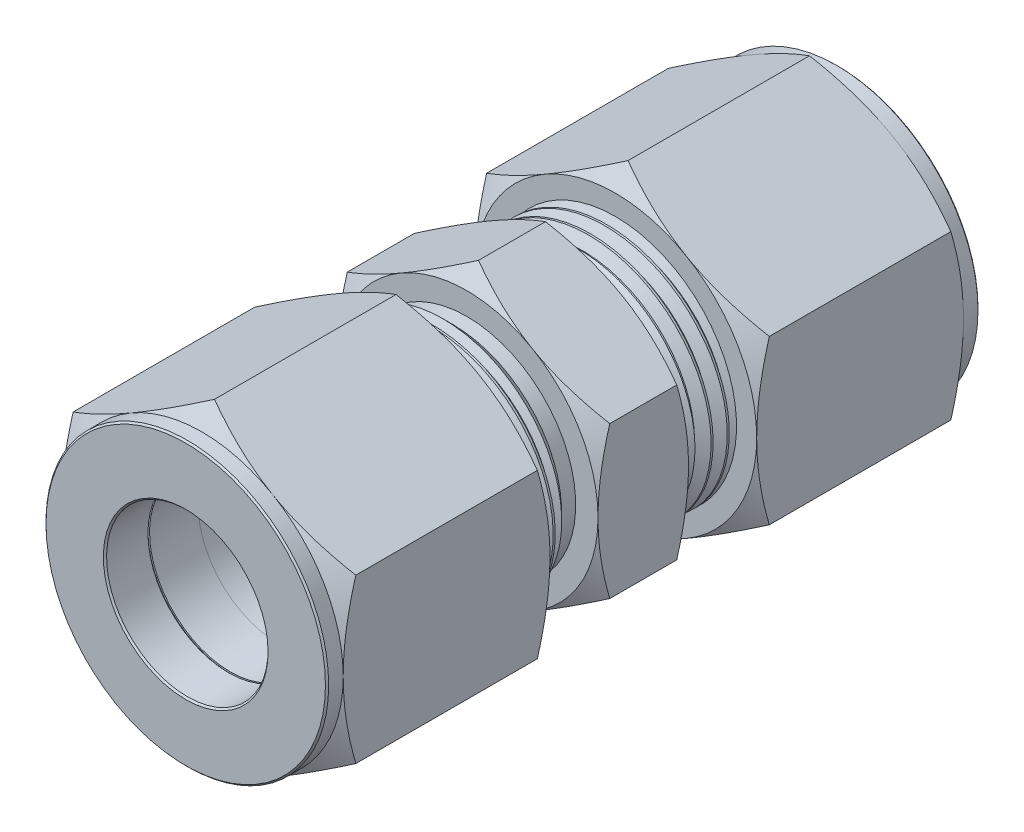
from build123d import *

# Parameters (mm, degrees)
BOSS_EXTRUDE1_DEPTH = 17.526
CHAMFER1_SIZE       = 0.127
SKETCH4_W           = 15.494
SKETCH4_H           = 9.525
CUT_SWEEP1_PITCH    = 1.27
BOSS_EXTRUDE2_DEPTH = 3.556
CIRPATTERN1_COUNT   = 2


with BuildPart() as part:
    # Sketch2 → Boss-Extrude1 (new body)
    with BuildSketch(Plane.XY):
        Polygon((0, 12.831609733), (-11.1125, 6.415804866), (-11.1125, -6.415804866), (0, -12.831609733), (11.1125, -6.415804866), (11.1125, 6.415804866), align=None)
    extrude(amount=-BOSS_EXTRUDE1_DEPTH)

    # Sketch3 → Cut-Revolve1 (revolve, cut)
    with BuildSketch(Plane(origin=(0, 0, 0), x_dir=(0, 0, -1), z_dir=(1, 0, 0)), mode=Mode.PRIVATE) as cut_revolve1_sk:
        Polygon((0, 12.831609733), (0, 11.1125), (1.27, 11.1125), (2.262528467, 12.831609733), (16.533471533, 12.831609733), (17.526, 11.1125), (17.526, 12.831609733), (17.526, 14.550719465), (0, 14.550719465), align=None)
        Polygon((0, 6.35), (0, 0), (17.526, 0), (17.526, 9.525), (7.0104, 9.525), (7.0104, 8.89), (3.5052, 8.89), (3.5052, 8.255), (3.5052, 6.35), align=None)
    revolve(cut_revolve1_sk.sketch.rotate(Axis((0, 0, 0), (0, 0, -1)), 180), axis=Axis((0, 0, 0), (0, 0, -1)), mode=Mode.SUBTRACT)

    # Chamfer1
    chamfer1_edges = [part.edges().sort_by_distance(p)[0] for p in [
        (0, 11.1125, 0),
        (0, 6.35, -3.5052),
        (0, 6.35, 0),
    ]]
    chamfer(chamfer1_edges, length=CHAMFER1_SIZE)


with BuildPart() as body_2:
    # Sketch4 → Revolve1 (revolve)
    with BuildSketch(Plane(origin=(0, 0, 0), x_dir=(0, 0, -1), z_dir=(1, 0, 0))):
        with Locations((17.907, 4.7625)):
            Rectangle(SKETCH4_W, SKETCH4_H)
    revolve(axis=Axis((0, 0, -25.654), (0, 0, 1)))

    # Cut-Sweep1: the profile of Sketch6 screwed along a right-hand helix of 13.2 turns, 8 arcs to a turn; built about Z, then put on its axis
    cut_sweep1_z = Axis((0, 0, 0), (0, 0, 1))
    cut_sweep1_corners = [(8.700110803, 0, -0.635), (9.593740766, 0, -1.1509375), (9.593740766, 0, 0.0396875), (8.700110803, 0, -0.47625)]
    with BuildLine(mode=Mode.PRIVATE) as cut_sweep1_profile:
        Line(cut_sweep1_corners[0], cut_sweep1_corners[1])
        Line(cut_sweep1_corners[1], cut_sweep1_corners[2])
        Line(cut_sweep1_corners[2], cut_sweep1_corners[3])
        Line(cut_sweep1_corners[3], cut_sweep1_corners[0])
    cut_sweep1_cap = Face(cut_sweep1_profile.wire())
    cut_sweep1_turn_angles = [0, 22.5, 45, 67.5, 90, 112.5, 135, 157.5, 180, 202.5, 225, 247.5, 270, 292.5, 315, 337.5, 360]
    cut_sweep1_turn_weights = [1, 0.9238795325112867, 1, 0.9238795325112867, 1, 0.9238795325112867, 1, 0.9238795325112867, 1, 0.9238795325112867, 1, 0.9238795325112867, 1, 0.9238795325112867, 1, 0.9238795325112867, 1]
    cut_sweep1_turn_rails = [Edge.make_bspline([Vector(p[0], p[1], 0).rotate(cut_sweep1_z, cut_sweep1_turn_angles[k]) / cut_sweep1_turn_weights[k] + Vector(0, 0, p[2] + CUT_SWEEP1_PITCH * cut_sweep1_turn_angles[k] / 360) for k in range(17)], [0, 0, 0, 1, 1, 2, 2, 3, 3, 4, 4, 5, 5, 6, 6, 7, 7, 8, 8, 8], 2, cut_sweep1_turn_weights) for p in cut_sweep1_corners]
    cut_sweep1_turn_sides = [Face.make_surface_from_curves(cut_sweep1_turn_rails[p[0]], cut_sweep1_turn_rails[p[1]]) for p in [(0, 1), (1, 2), (2, 3), (3, 0)]]
    cut_sweep1_last_angles = [4680, 4702.5, 4725, 4738.5, 4752]
    cut_sweep1_last_weights = [1, 0.9238795325112867, 1, 0.9723699203976544, 1]
    cut_sweep1_last_rails = [Edge.make_bspline([Vector(p[0], p[1], 0).rotate(cut_sweep1_z, cut_sweep1_last_angles[k]) / cut_sweep1_last_weights[k] + Vector(0, 0, p[2] + CUT_SWEEP1_PITCH * cut_sweep1_last_angles[k] / 360) for k in range(5)], [0, 0, 0, 1, 1, 2, 2, 2], 2, cut_sweep1_last_weights) for p in cut_sweep1_corners]
    cut_sweep1_last_sides = [Face.make_surface_from_curves(cut_sweep1_last_rails[p[0]], cut_sweep1_last_rails[p[1]]) for p in [(0, 1), (1, 2), (2, 3), (3, 0)]]
    cut_sweep1 = Plane(origin=(0, 0, -10.16), x_dir=(0, 1, 0), z_dir=(0, 0, -1)) * Solid(Shell([*[p.moved(Location((0, 0, CUT_SWEEP1_PITCH * i))) for i in range(13) for p in cut_sweep1_turn_sides], *cut_sweep1_last_sides, cut_sweep1_cap, cut_sweep1_cap.rotate(cut_sweep1_z, 4752).moved(Location((0, 0, CUT_SWEEP1_PITCH * 4752 / 360)))]))
    add(cut_sweep1, mode=Mode.SUBTRACT)

    # Sketch7 → Boss-Extrude2 (add)
    with BuildSketch(Plane(origin=(0, 0, -25.654), x_dir=(-1, 0, 0), z_dir=(0, 0, -1))):
        Polygon((0, 11.91506618), (-10.31875, 5.95753309), (-10.31875, -5.95753309), (0, -11.91506618), (10.31875, -5.95753309), (10.31875, 5.95753309), align=None)
    extrude(amount=-BOSS_EXTRUDE2_DEPTH)

    # Sketch8 → Cut-Revolve2 (revolve, cut)
    with BuildSketch(Plane(origin=(0, 0, 0), x_dir=(0, 0, -1), z_dir=(1, 0, 0)), mode=Mode.PRIVATE) as cut_revolve2_sk:
        Polygon((10.16, 9.662481533), (10.16, 8.56262927), (11.259852263, 9.662481533), align=None)
        Polygon((22.098, 9.662481533), (19.898295474, 9.662481533), (20.998147737, 8.56262927), (22.098, 8.56262927), align=None)
        Polygon((22.098, 10.31875), (23.019633576, 11.91506618), (25.654, 11.91506618), (25.654, 13.511382361), (22.098, 13.511382361), (22.098, 11.91506618), align=None)
        Polygon((22.86, 5.1562), (25.654, 5.1562), (25.654, 0), (10.16, 0), (10.16, 7.698316667), (15.70736, 6.35), (22.86, 6.35), align=None)
    revolve(cut_revolve2_sk.sketch.rotate(Axis((0, 0, 0), (0, 0, -1)), 180), axis=Axis((0, 0, 0), (0, 0, -1)), mode=Mode.SUBTRACT)


with BuildPart() as body_3:
    # Sketch9 → Revolve2 (revolve)
    with BuildSketch(Plane(origin=(0, 0, 0), x_dir=(0, 0, -1), z_dir=(1, 0, 0)), mode=Mode.PRIVATE) as revolve2_sk:
        Polygon((6.1976, 8.6614), (6.1976, 7.4676), (7.3152, 6.35), (13.5128, 6.35), (13.5128, 6.8834), align=None)
    revolve(revolve2_sk.sketch.rotate(Axis((0, 0, 0), (0, 0, -1)), 180), axis=Axis((0, 0, 0), (0, 0, -1)))


with BuildPart() as body_4:
    # Sketch10 → Revolve3 (revolve)
    with BuildSketch(Plane(origin=(0, 0, 0), x_dir=(0, 0, -1), z_dir=(1, 0, 0)), mode=Mode.PRIVATE) as revolve3_sk:
        Polygon((3.5052, 7.8359), (4.7752, 7.8359), (4.7752, 7.4676), (6.1976, 7.4676), (7.3152, 6.35), (3.5052, 6.35), align=None)
    revolve(revolve3_sk.sketch.rotate(Axis((0, 0, 0), (0, 0, -1)), 180), axis=Axis((0, 0, 0), (0, 0, -1)))


with BuildPart() as cirpattern1_1:
    # CirPattern1: pattern copy
    add(body_2.part.rotate(Axis((0, 0, -25.654), (1, 0, 0)), 1 * 360 / CIRPATTERN1_COUNT))

    # Combine1: union body 2
    add(body_2.part)


with BuildPart() as cirpattern1_2:
    # CirPattern1: pattern copy
    add(part.part.rotate(Axis((0, 0, -25.654), (1, 0, 0)), 1 * 360 / CIRPATTERN1_COUNT))


with BuildPart() as cirpattern1_3:
    # CirPattern1: pattern copy
    add(body_4.part.rotate(Axis((0, 0, -25.654), (1, 0, 0)), 1 * 360 / CIRPATTERN1_COUNT))


with BuildPart() as cirpattern1_4:
    # CirPattern1: pattern copy
    add(body_3.part.rotate(Axis((0, 0, -25.654), (1, 0, 0)), 1 * 360 / CIRPATTERN1_COUNT))


solid = Compound([part.part, body_3.part, body_4.part, cirpattern1_1.part, cirpattern1_2.part, cirpattern1_3.part, cirpattern1_4.part])
